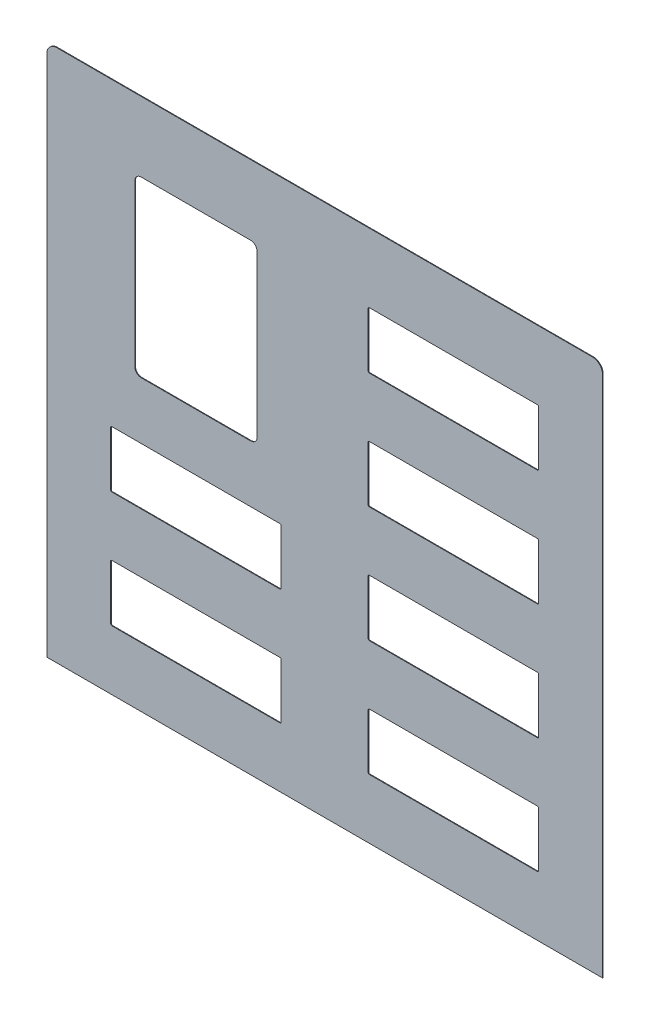
from build123d import *

# Parameters (mm, degrees)
BASE_FLANGE1_DEPTH = 1
CUT_EXTRUDE1_DEPTH = 10
CUT_EXTRUDE2_DEPTH = 10


# Sheet-metal steps are written as plain solids
with BuildPart() as part:
    # Sketch1 → Base-Flange1 (new body)
    with BuildSketch(Plane.XY):
        with BuildLine():
            Line((0, 0), (863.4, 0))
            Line((863.4, 0), (863.4, 812))
            ThreePointArc((863.4, 812), (858.801576465, 823.101576465), (847.7, 827.7))
            Line((847.7, 827.7), (15.7, 827.7))
            ThreePointArc((15.7, 827.7), (4.598423535, 823.101576465), (0, 812))
            Line((0, 812), (0, 0))
        make_face()
    extrude(amount=-BASE_FLANGE1_DEPTH)

    # Sketch9 → Cut-Extrude1 (cut)
    with BuildSketch(Plane.XY):
        with BuildLine():
            Line((762.2, 720.7), (501.2, 720.7))
            ThreePointArc((501.2, 720.7), (499.785786438, 720.114213562), (499.2, 718.7))
            Line((499.2, 718.7), (499.2, 634.7))
            ThreePointArc((499.2, 634.7), (499.785786438, 633.285786438), (501.2, 632.7))
            Line((501.2, 632.7), (762.2, 632.7))
            ThreePointArc((762.2, 632.7), (763.614213562, 633.285786438), (764.2, 634.7))
            Line((764.2, 634.7), (764.2, 718.7))
            ThreePointArc((764.2, 718.7), (763.614213562, 720.114213562), (762.2, 720.7))
        make_face()
        with BuildLine():
            Line((764.2, 538.7), (764.2, 454.7))
            ThreePointArc((764.2, 454.7), (763.614213562, 453.285786438), (762.2, 452.7))
            Line((762.2, 452.7), (501.2, 452.7))
            ThreePointArc((501.2, 452.7), (499.785786438, 453.285786438), (499.2, 454.7))
            Line((499.2, 454.7), (499.2, 538.7))
            ThreePointArc((499.2, 538.7), (499.785786438, 540.114213562), (501.2, 540.7))
            Line((501.2, 540.7), (762.2, 540.7))
            ThreePointArc((762.2, 540.7), (763.614213562, 540.114213562), (764.2, 538.7))
        make_face()
        with BuildLine():
            Line((764.2, 358.7), (764.2, 274.7))
            ThreePointArc((764.2, 274.7), (763.614213562, 273.285786438), (762.2, 272.7))
            Line((762.2, 272.7), (501.2, 272.7))
            ThreePointArc((501.2, 272.7), (499.785786438, 273.285786438), (499.2, 274.7))
            Line((499.2, 274.7), (499.2, 358.7))
            ThreePointArc((499.2, 358.7), (499.785786438, 360.114213562), (501.2, 360.7))
            Line((501.2, 360.7), (762.2, 360.7))
            ThreePointArc((762.2, 360.7), (763.614213562, 360.114213562), (764.2, 358.7))
        make_face()
        with BuildLine():
            Line((764.2, 178.7), (764.2, 94.7))
            ThreePointArc((764.2, 94.7), (763.614213562, 93.285786438), (762.2, 92.7))
            Line((762.2, 92.7), (501.2, 92.7))
            ThreePointArc((501.2, 92.7), (499.785786438, 93.285786438), (499.2, 94.7))
            Line((499.2, 94.7), (499.2, 178.7))
            ThreePointArc((499.2, 178.7), (499.785786438, 180.114213562), (501.2, 180.7))
            Line((501.2, 180.7), (762.2, 180.7))
            ThreePointArc((762.2, 180.7), (763.614213562, 180.114213562), (764.2, 178.7))
        make_face()
        with BuildLine():
            Line((364.2, 358.7), (364.2, 274.7))
            ThreePointArc((364.2, 274.7), (363.614213562, 273.285786438), (362.2, 272.7))
            Line((362.2, 272.7), (101.2, 272.7))
            ThreePointArc((101.2, 272.7), (99.785786438, 273.285786438), (99.2, 274.7))
            Line((99.2, 274.7), (99.2, 358.7))
            ThreePointArc((99.2, 358.7), (99.785786438, 360.114213562), (101.2, 360.7))
            Line((101.2, 360.7), (362.2, 360.7))
            ThreePointArc((362.2, 360.7), (363.614213562, 360.114213562), (364.2, 358.7))
        make_face()
        with BuildLine():
            Line((364.2, 178.7), (364.2, 94.7))
            ThreePointArc((364.2, 94.7), (363.614213562, 93.285786438), (362.2, 92.7))
            Line((362.2, 92.7), (101.2, 92.7))
            ThreePointArc((101.2, 92.7), (99.785786438, 93.285786438), (99.2, 94.7))
            Line((99.2, 94.7), (99.2, 178.7))
            ThreePointArc((99.2, 178.7), (99.785786438, 180.114213562), (101.2, 180.7))
            Line((101.2, 180.7), (362.2, 180.7))
            ThreePointArc((362.2, 180.7), (363.614213562, 180.114213562), (364.2, 178.7))
        make_face()
    extrude(amount=-CUT_EXTRUDE1_DEPTH, mode=Mode.SUBTRACT)

    # Sketch10 → Cut-Extrude2 (cut)
    with BuildSketch(Plane.XY):
        with BuildLine():
            Line((146.7, 449.2), (316.7, 449.2))
            ThreePointArc((316.7, 449.2), (323.771067812, 452.128932188), (326.7, 459.2))
            Line((326.7, 459.2), (326.7, 709.2))
            ThreePointArc((326.7, 709.2), (323.771067812, 716.271067812), (316.7, 719.2))
            Line((316.7, 719.2), (146.7, 719.2))
            ThreePointArc((146.7, 719.2), (139.628932188, 716.271067812), (136.7, 709.2))
            Line((136.7, 709.2), (136.7, 459.2))
            ThreePointArc((136.7, 459.2), (139.628932188, 452.128932188), (146.7, 449.2))
        make_face()
    extrude(amount=-CUT_EXTRUDE2_DEPTH, mode=Mode.SUBTRACT)


solid = part.part
